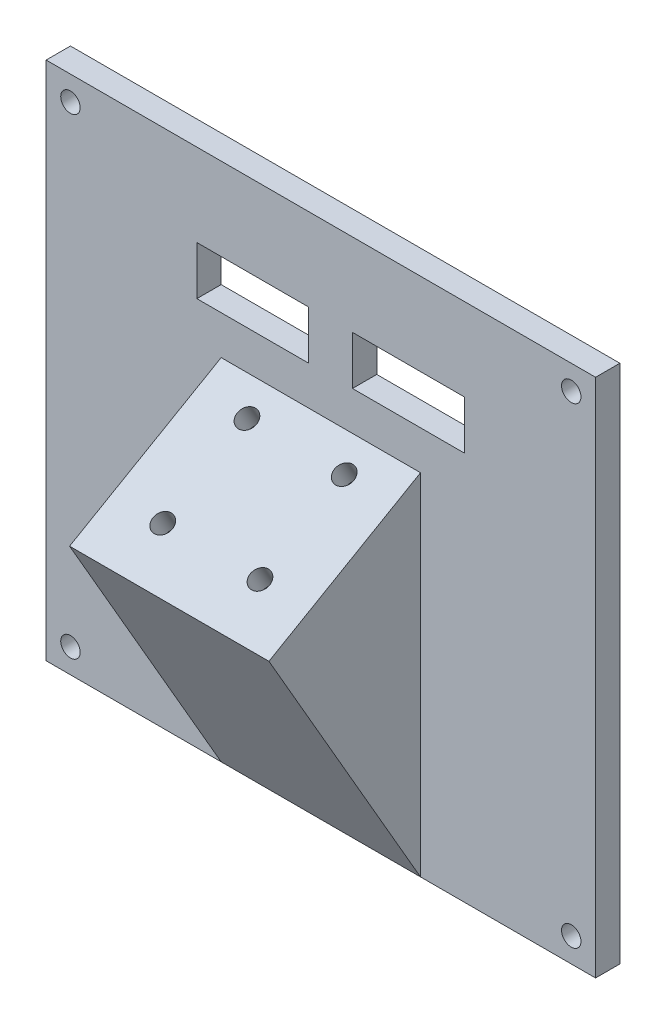
from build123d import *

# Parameters (mm, degrees)
SKETCH1_W           = 113
SKETCH1_H           = 107
BOSS_EXTRUDE1_DEPTH = 20
SKETCH2_W           = 93
SKETCH2_H           = 87
CUT_EXTRUDE1_DEPTH  = 15
BOSS_EXTRUDE4_DEPTH = 20.5
SKETCH7_W           = 23
SKETCH7_H           = 10
CUT_EXTRUDE2_DEPTH  = 41
SKETCH10_R          = 2
CUT_EXTRUDE3_DEPTH  = 94.132038426
SKETCH12_R          = 2
CUT_EXTRUDE5_DEPTH  = 103.128679215
SKETCH15_W          = 118.362800564
SKETCH15_H          = 111.14113597
CUT_EXTRUDE7_DEPTH  = 86.809493329
SKETCH17_R          = 5
CUT_EXTRUDE8_DEPTH  = 100.93804781


with BuildPart() as part:
    # Sketch1 → Boss-Extrude1 (new body)
    with BuildSketch(Plane.XY):
        Rectangle(SKETCH1_W, SKETCH1_H)
    extrude(amount=BOSS_EXTRUDE1_DEPTH)

    # Sketch2 → Cut-Extrude1 (cut)
    with BuildSketch(Plane(origin=(0, 0, 0), x_dir=(-1, 0, 0), z_dir=(0, 0, -1))):
        Rectangle(SKETCH2_W, SKETCH2_H)
    extrude(amount=-CUT_EXTRUDE1_DEPTH, mode=Mode.SUBTRACT)

    # Sketch9 → Boss-Extrude4 (add, symmetric)
    with BuildSketch(Plane.ZY):
        Polygon((20, -53.5), (51.176914536, 0.5), (20, 18.5), align=None)
    extrude(amount=BOSS_EXTRUDE4_DEPTH, both=True)

    # Sketch7 → Cut-Extrude2 (cut)
    with BuildSketch(Plane(origin=(0, 0, 15), x_dir=(-1, 0, 0), z_dir=(0, 0, -1))):
        with Locations((-18, 31.5)):
            Rectangle(SKETCH7_W, SKETCH7_H)
        with Locations((14, 31.5)):
            Rectangle(SKETCH7_W, SKETCH7_H)
    extrude(amount=-CUT_EXTRUDE2_DEPTH, mode=Mode.SUBTRACT)

    # Sketch10 → Cut-Extrude3 (cut, through all)
    with BuildSketch(Plane(origin=(0, 0, 0), x_dir=(-1, 0, 0), z_dir=(0, 0, -1))):
        with Locations((-51.5, 48.5)):
            Circle(SKETCH10_R)
        with Locations((51.5, 48.5)):
            Circle(SKETCH10_R)
        with Locations((51.5, -48.5)):
            Circle(SKETCH10_R)
        with Locations((-51.5, -48.5)):
            Circle(SKETCH10_R)
    extrude(amount=-CUT_EXTRUDE3_DEPTH, mode=Mode.SUBTRACT)

    # Sketch12 → Cut-Extrude5 (cut, through all)
    with BuildSketch(Plane(origin=(0, 22.535254038, 13.010734985), x_dir=(1, 0, 0), z_dir=(0, 0.8660254037844416, 0.49999999999999517))):
        with Locations((-10, -14.070508076)):
            Circle(SKETCH12_R)
        with Locations((10, -14.070508076)):
            Circle(SKETCH12_R)
        with Locations((-10, -34.070508076)):
            Circle(SKETCH12_R)
        with Locations((10, -34.070508076)):
            Circle(SKETCH12_R)
    extrude(amount=-CUT_EXTRUDE5_DEPTH, mode=Mode.SUBTRACT)

    # Sketch15 → Cut-Extrude7 (cut, through all)
    with BuildSketch(Plane(origin=(0, 0, 15), x_dir=(-1, 0, 0), z_dir=(0, 0, -1))):
        Rectangle(SKETCH15_W, SKETCH15_H)
    extrude(amount=CUT_EXTRUDE7_DEPTH, mode=Mode.SUBTRACT)

    # Sketch17 → Cut-Extrude8 (cut, through all)
    with BuildSketch(Plane(origin=(0, 18.205127019, 10.510734985), x_dir=(1, 0, 0), z_dir=(0, 0.8660254037844415, 0.4999999999999951))):
        with Locations((10, -34.070508076)):
            Circle(SKETCH17_R)
        with Locations((-10, -34.070508076)):
            Circle(SKETCH17_R)
        with Locations((-10, -14.070508076)):
            Circle(SKETCH17_R)
        with Locations((10, -14.070508076)):
            Circle(SKETCH17_R)
    extrude(amount=-CUT_EXTRUDE8_DEPTH, mode=Mode.SUBTRACT)


solid = part.part
